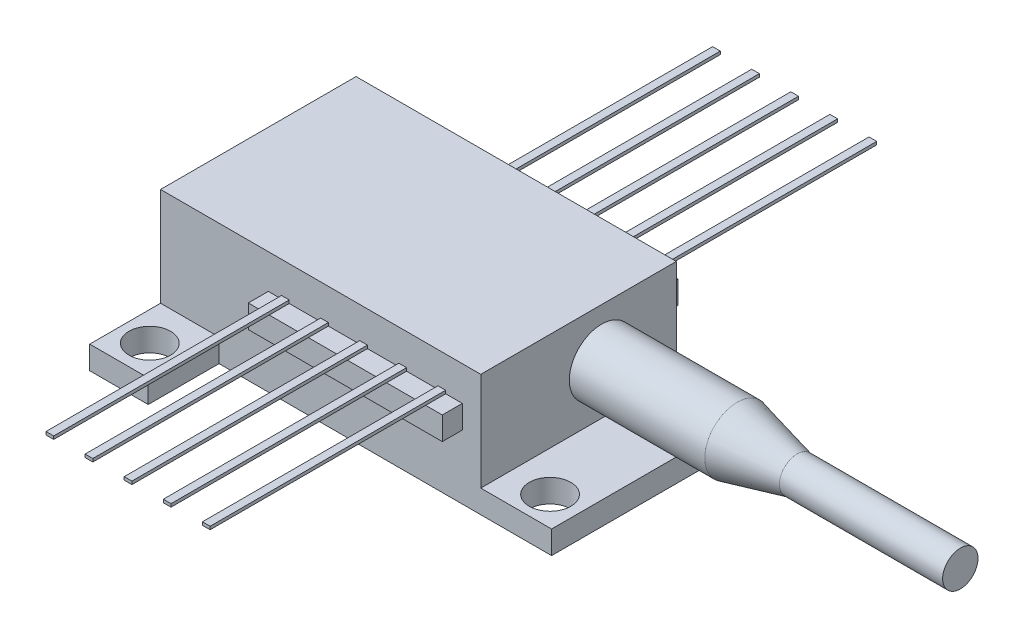
from build123d import *

# Parameters (mm, degrees)
SKETCH1_W               = 20.8
SKETCH1_H               = 12.7
BOSS_EXTRUDE1_DEPTH     = 6.4
BOSS_EXTRUDE2_DEPTH     = 1.5
SKETCH5_R               = 1.35
CUT_EXTRUDE1_DEPTH      = 21.181984541
SKETCH9_W               = 12.6
SKETCH9_H               = 1.3
BOSS_EXTRUDE4_DEPTH     = 1.5
SKETCH10_W              = 0.5
SKETCH10_H              = 15.3
BOSS_EXTRUDE5_DEPTH     = 0.2
LPATTERN1_COUNT         = 5
LPATTERN1_PITCH         = 2.54
MIRROR2_COPY_1_SKETCH_W = 0.5
MIRROR2_COPY_1_SKETCH_H = 15.3
MIRROR2_COPY_1_DEPTH    = 0.2
MIRROR2_COPY_2_SKETCH_W = 0.5
MIRROR2_COPY_2_SKETCH_H = 15.3
MIRROR2_COPY_2_DEPTH    = 0.2
MIRROR2_COPY_3_SKETCH_W = 0.5
MIRROR2_COPY_3_SKETCH_H = 15.3
MIRROR2_COPY_3_DEPTH    = 0.2
MIRROR2_COPY_4_SKETCH_W = 0.5
MIRROR2_COPY_4_SKETCH_H = 15.3
MIRROR2_COPY_4_DEPTH    = 0.2


with BuildPart() as part:
    # Sketch1 → Boss-Extrude1 (new body)
    with BuildSketch(Plane(origin=(0, 0, 0), x_dir=(1, 0, 0), z_dir=(0, 1, 0))):
        Rectangle(SKETCH1_W, SKETCH1_H)
    extrude(amount=BOSS_EXTRUDE1_DEPTH)

    # Sketch3 → Boss-Extrude2 (add)
    with BuildSketch(Plane.XZ):
        Polygon((-10.4, 10.95), (-6.6, 10.95), (-6.6, 6.35), (15, 6.35), (15, -6.35), (-6.6, -6.35), (-6.6, -10.95), (-10.4, -10.95), align=None)
    extrude(amount=BOSS_EXTRUDE2_DEPTH)

    # Sketch5 → Cut-Extrude1 (cut, through all)
    with BuildSketch(Plane.XZ.offset(1.5)):
        with Locations((-8.5, 8.95)):
            Circle(SKETCH5_R)
        with Locations((13, 4.45)):
            Circle(SKETCH5_R)
    cut_extrude1 = extrude(amount=-CUT_EXTRUDE1_DEPTH, mode=Mode.SUBTRACT)

    # Mirror3: Cut-Extrude1 across plane
    add(cut_extrude1.mirror(Plane.XY), mode=Mode.SUBTRACT)

    # Sketch11 → Revolve1 (revolve)
    with BuildSketch(Plane(origin=(0, 3.2, 0), x_dir=(-1, 0, 0), z_dir=(0, -1, 0))):
        Polygon((-10.4, 1.5), (-10.4, 3.6), (-19.2, 3.6), (-23.1, 2.65), (-33.7, 2.65), (-33.7, 1.5), align=None)
    revolve(axis=Axis((10.4, 3.2, -1.5), (1, 0, 0)))

    # Sketch9 → Boss-Extrude4 (add)
    with BuildSketch(Plane(origin=(0, 2.665, 0), x_dir=(-1, 0, 0), z_dir=(0, -1, 0))):
        with Locations((-2.9, -7)):
            Rectangle(SKETCH9_W, SKETCH9_H)
    boss_extrude4 = extrude(amount=-BOSS_EXTRUDE4_DEPTH)

    # Sketch10 → Boss-Extrude5 (add)
    with BuildSketch(Plane(origin=(0, 4.165, 0), x_dir=(1, 0, 0), z_dir=(0, 1, 0))):
        with Locations((7.87, -14)):
            Rectangle(SKETCH10_W, SKETCH10_H)
    boss_extrude5 = extrude(amount=BOSS_EXTRUDE5_DEPTH)

    # LPattern1: Boss-Extrude5 ×5
    with Locations(*[(-i * LPATTERN1_PITCH, 0, 0) for i in range(1, LPATTERN1_COUNT)]):
        add(boss_extrude5)

    # Mirror2: Boss-Extrude4, Boss-Extrude5 across plane
    add(boss_extrude4.mirror(Plane.XY))
    add(boss_extrude5.mirror(Plane.XY))

    # Mirror2 copy 1 sketch → Mirror2 copy 1 (add)
    with BuildSketch(Plane(origin=(-2.54, 4.165, 0), x_dir=(1, 0, 0), z_dir=(0, 1, 0))):
        with Locations((7.87, 14)):
            Rectangle(MIRROR2_COPY_1_SKETCH_W, MIRROR2_COPY_1_SKETCH_H)
    extrude(amount=MIRROR2_COPY_1_DEPTH)

    # Mirror2 copy 2 sketch → Mirror2 copy 2 (add)
    with BuildSketch(Plane(origin=(-5.08, 4.165, 0), x_dir=(1, 0, 0), z_dir=(0, 1, 0))):
        with Locations((7.87, 14)):
            Rectangle(MIRROR2_COPY_2_SKETCH_W, MIRROR2_COPY_2_SKETCH_H)
    extrude(amount=MIRROR2_COPY_2_DEPTH)

    # Mirror2 copy 3 sketch → Mirror2 copy 3 (add)
    with BuildSketch(Plane(origin=(-7.62, 4.165, 0), x_dir=(1, 0, 0), z_dir=(0, 1, 0))):
        with Locations((7.87, 14)):
            Rectangle(MIRROR2_COPY_3_SKETCH_W, MIRROR2_COPY_3_SKETCH_H)
    extrude(amount=MIRROR2_COPY_3_DEPTH)

    # Mirror2 copy 4 sketch → Mirror2 copy 4 (add)
    with BuildSketch(Plane(origin=(-10.16, 4.165, 0), x_dir=(1, 0, 0), z_dir=(0, 1, 0))):
        with Locations((7.87, 14)):
            Rectangle(MIRROR2_COPY_4_SKETCH_W, MIRROR2_COPY_4_SKETCH_H)
    extrude(amount=MIRROR2_COPY_4_DEPTH)


solid = part.part
